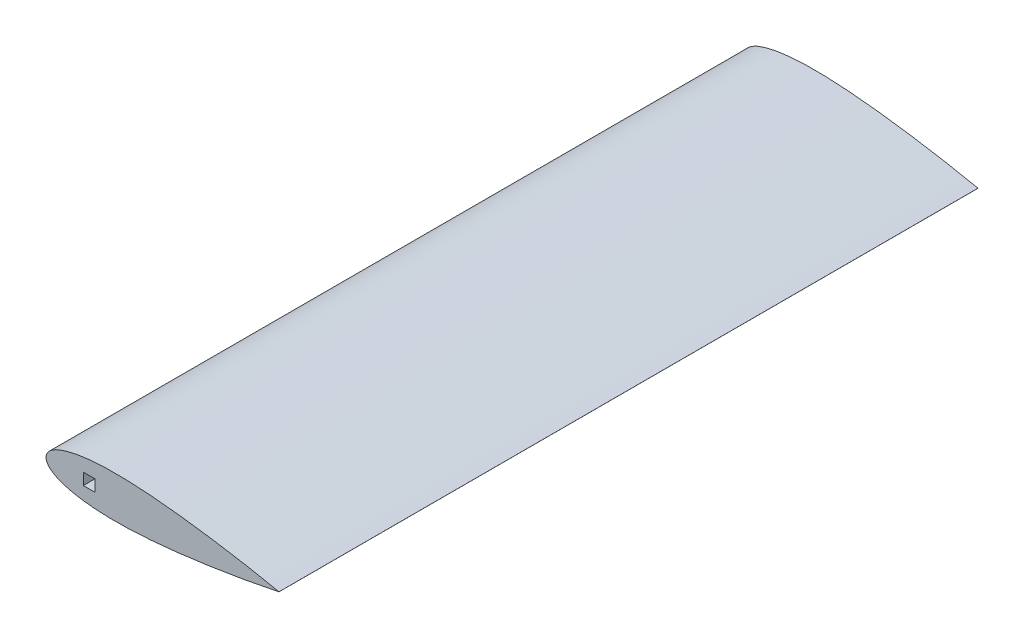
from build123d import *

# Parameters (mm, degrees)
BOSS_EXTRUDE1_DEPTH     = 600
SKETCH6_W               = 10
SKETCH6_H               = 10
CUT_EXTRUDE2_DEPTH      = 656
CUT_EXTRUDE4_DEPTH      = 42
CUT_EXTRUDE4_DEPTH_BACK = 2
SKETCH8_W               = 14
SKETCH8_H               = 14
SKETCH9_W               = 14
SKETCH9_H               = 14
CUT_EXTRUDE5_DEPTH      = 14
SKETCH10_W              = 14
SKETCH10_H              = 14
CUT_EXTRUDE6_DEPTH      = 14
SKETCH11_W              = 10
SKETCH11_H              = 10
CUT_EXTRUDE7_DEPTH      = 654
SKETCH12_W              = 10
SKETCH12_H              = 10
BOSS_EXTRUDE3_DEPTH     = 600
SKETCH13_W              = 10
SKETCH13_H              = 14
CUT_EXTRUDE8_DEPTH      = 10
SKETCH14_W              = 10
SKETCH14_H              = 14
CUT_EXTRUDE9_DEPTH      = 10
SKETCH16_W              = 14
SKETCH16_H              = 4.5
CUT_EXTRUDE10_DEPTH     = 10
SKETCH17_W              = 14
SKETCH17_H              = 4.5
CUT_EXTRUDE11_DEPTH     = 14


with BuildPart() as part:
    # Sketch2 → Boss-Extrude1 (new body)
    with BuildSketch(Plane.XY):
        with BuildLine():
            Line((200, 0.026021305), (200, -0.026021313))
            add(Edge.make_bspline(
                [(200, 0.026021305), (196.133660298, 0.824460007), (188.973100367, 2.314029776), (175.197231938, 4.95350612), (158.682087923, 7.864416996), (138.848303334, 10.963035098), (119.017582397, 13.652387002), (99.186590163, 15.851924276), (79.350823181, 17.41083287), (62.801573061, 17.964567123), (49.570059005, 17.74356646), (39.638389621, 17.155457266), (29.688048318, 16.020003739), (21.406431266, 14.43331701), (14.801094645, 12.546196453), (9.75689383, 10.639636938), (5.531834741, 8.343752603), (1.645401824, 5.168264306), (-1.073716587, 0), (1.645401824, -5.168264306), (5.53183474, -8.343752603), (9.756893829, -10.639636938), (14.801094645, -12.546196453), (21.406431266, -14.43331701), (29.688048318, -16.02000374), (39.63838962, -17.155457267), (49.570059005, -17.743566462), (62.801573061, -17.964567125), (79.350823181, -17.410832873), (99.186590162, -15.85192428), (119.017582396, -13.652387007), (138.848303334, -10.963035103), (158.682087923, -7.864417002), (175.197231937, -4.953506127), (188.973100367, -2.314029784), (196.133660298, -0.824460015), (200, -0.026021313)],
                knots=[-0.004189875, -0.004189875, -0.004189875, -0.004189875, 0.024603844, 0.049152359, 0.098108667, 0.146905312, 0.195554797, 0.244056277, 0.292409554, 0.340643731, 0.364754111, 0.3889056, 0.413178108, 0.437756239, 0.450304697, 0.463229879, 0.477067953, 0.485035559, 0.5, 0.514964441, 0.522932047, 0.536770121, 0.549695303, 0.562243761, 0.586821892, 0.6110944, 0.635245889, 0.659356269, 0.707590446, 0.755943723, 0.804445203, 0.853094688, 0.901891333, 0.950847641, 0.975396156, 1.004189875, 1.004189875, 1.004189875, 1.004189875], degree=3))
        make_face()
    extrude(amount=BOSS_EXTRUDE1_DEPTH)

    # Sketch6 → Cut-Extrude2 (cut)
    with BuildSketch(Plane.XY.offset(600)):
        with Locations((25, 0)):
            Rectangle(SKETCH6_W, SKETCH6_H)
    extrude(amount=-CUT_EXTRUDE2_DEPTH, mode=Mode.SUBTRACT)

    # Sketch8 → Cut-Extrude4 (cut, two sides: drawn at the far end of the back side and taken through both)
    with BuildSketch(Plane(origin=(0, 5, 0), x_dir=(-1, 0, 0), z_dir=(0, -1, 0)).offset(-CUT_EXTRUDE4_DEPTH_BACK)):
        with Locations((-25, -357)):
            Rectangle(SKETCH8_W, SKETCH8_H)
        with Locations((-25, -243)):
            Rectangle(SKETCH8_W, SKETCH8_H)
    extrude(amount=CUT_EXTRUDE4_DEPTH + CUT_EXTRUDE4_DEPTH_BACK, mode=Mode.SUBTRACT)

    # Sketch9 → Cut-Extrude5 (cut)
    with BuildSketch(Plane.ZY.offset(-32)):
        with Locations((357, 0)):
            Rectangle(SKETCH9_W, SKETCH9_H)
    extrude(amount=-CUT_EXTRUDE5_DEPTH, mode=Mode.SUBTRACT)

    # Sketch10 → Cut-Extrude6 (cut)
    with BuildSketch(Plane.ZY.offset(-32)):
        with Locations((243, 0)):
            Rectangle(SKETCH10_W, SKETCH10_H)
    extrude(amount=-CUT_EXTRUDE6_DEPTH, mode=Mode.SUBTRACT)

    # Sketch11 → Cut-Extrude7 (cut)
    with BuildSketch(Plane.XY.offset(600)):
        with Locations((37, 0)):
            Rectangle(SKETCH11_W, SKETCH11_H)
    extrude(amount=-CUT_EXTRUDE7_DEPTH, mode=Mode.SUBTRACT)

    # Sketch12 → Boss-Extrude3 (add)
    with BuildSketch(Plane.XY.offset(600)):
        with Locations((25, 0)):
            Rectangle(SKETCH12_W, SKETCH12_H)
    extrude(amount=-BOSS_EXTRUDE3_DEPTH)

    # Sketch13 → Cut-Extrude8 (cut)
    with BuildSketch(Plane(origin=(0, -5, 0), x_dir=(-1, 0, 0), z_dir=(0, -1, 0))):
        with Locations((-25, -243)):
            Rectangle(SKETCH13_W, SKETCH13_H)
    extrude(amount=-CUT_EXTRUDE8_DEPTH, mode=Mode.SUBTRACT)

    # Sketch14 → Cut-Extrude9 (cut)
    with BuildSketch(Plane(origin=(0, -5, 0), x_dir=(-1, 0, 0), z_dir=(0, -1, 0))):
        with Locations((-25, -357)):
            Rectangle(SKETCH14_W, SKETCH14_H)
    extrude(amount=-CUT_EXTRUDE9_DEPTH, mode=Mode.SUBTRACT)

    # Sketch16 → Cut-Extrude10 (cut)
    with BuildSketch(Plane.ZY.offset(-46)):
        with Locations((357, -4.75)):
            Rectangle(SKETCH16_W, SKETCH16_H)
    extrude(amount=-CUT_EXTRUDE10_DEPTH, mode=Mode.SUBTRACT)

    # Sketch17 → Cut-Extrude11 (cut)
    with BuildSketch(Plane.ZY.offset(-46)):
        with Locations((357, -0.25)):
            Rectangle(SKETCH17_W, SKETCH17_H)
    extrude(amount=-CUT_EXTRUDE11_DEPTH, mode=Mode.SUBTRACT)


solid = part.part
